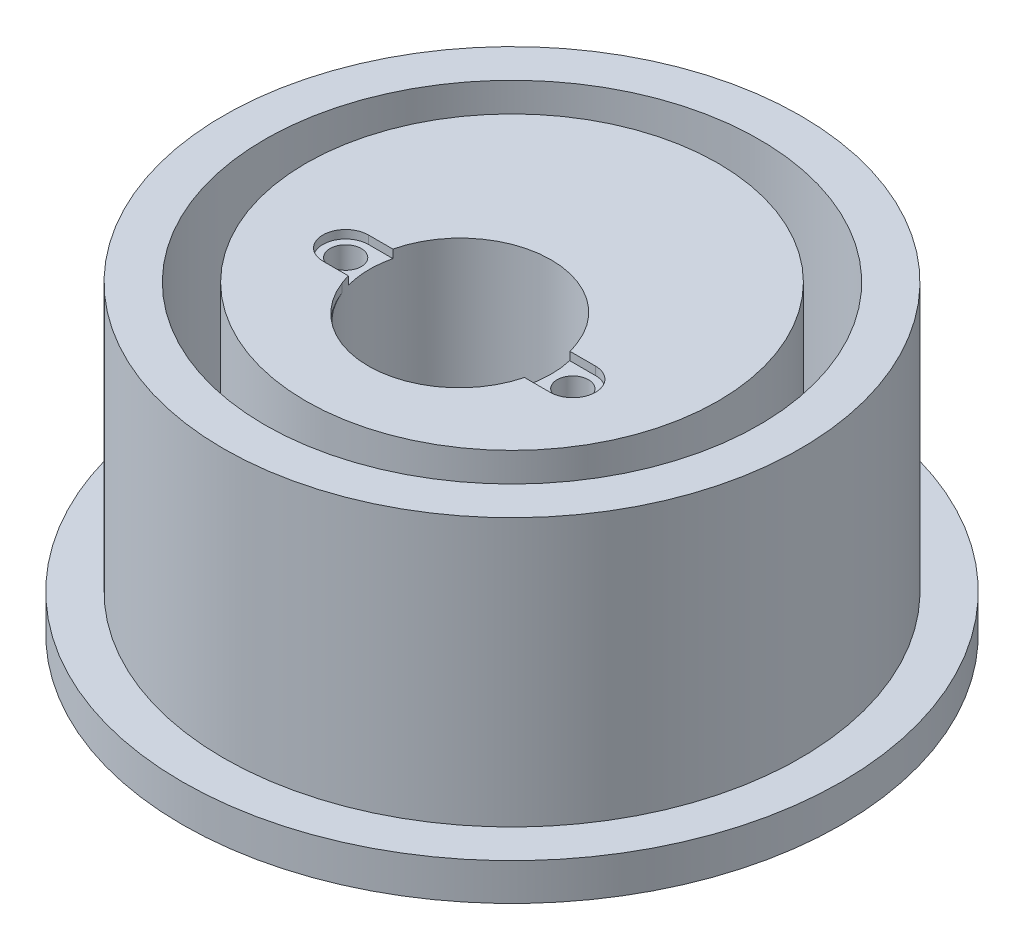
from build123d import *

# Parameters (mm, degrees)
SKETCH2_R           = 44.45
BOSS_EXTRUDE1_DEPTH = 6.35
SKETCH2_3_R         = 44.45
SKETCH2_3_R_2       = 38.1
BOSS_EXTRUDE2_DEPTH = 46.99
SKETCH3_R           = 31.75
SKETCH3_R_2         = 14
BOSS_EXTRUDE4_DEPTH = 40.64
CUT_EXTRUDE1_START  = -1.27
CUT_EXTRUDE1_DEPTH  = 1.27
SKETCH4_3_R         = 2.413
CUT_EXTRUDE2_DEPTH  = 8.89
SKETCH5_R           = 50.8
BOSS_EXTRUDE5_DEPTH = 5.715


with BuildPart() as part:
    # Sketch2 → Boss-Extrude1 (new body)
    with BuildSketch(Plane(origin=(0, 0, 0), x_dir=(1, 0, 0), z_dir=(0, 1, 0))):
        Circle(SKETCH2_R)
    extrude(amount=BOSS_EXTRUDE1_DEPTH)

    # Sketch2<3> → Boss-Extrude2 (add)
    with BuildSketch(Plane(origin=(0, 0, 0), x_dir=(1, 0, 0), z_dir=(0, 1, 0))):
        Circle(SKETCH2_3_R)
        Circle(SKETCH2_3_R_2, mode=Mode.SUBTRACT)
    extrude(amount=BOSS_EXTRUDE2_DEPTH)

    # Sketch3 → Boss-Extrude4 (add)
    with BuildSketch(Plane(origin=(0, 6.35, 0), x_dir=(1, 0, 0), z_dir=(0, 1, 0))):
        Circle(SKETCH3_R)
        with Locations((0.028088934, -8.000057344)):
            Circle(SKETCH3_R_2, mode=Mode.SUBTRACT)
    extrude(amount=BOSS_EXTRUDE4_DEPTH)

    # Sketch4 → Cut-Extrude1 (cut)
    with BuildSketch(Plane(origin=(0, 46.99, 0), x_dir=(1, 0, 0), z_dir=(0, 1, 0)).offset(CUT_EXTRUDE1_START)):
        with BuildLine():
            ThreePointArc((-13.456816363, -11.762679984), (-13.9692833, -8.271296235), (-13.592461269, -4.762679984))
            Line((-13.592461269, -4.762679984), (-17.368671482, -4.762679984))
            ThreePointArc((-17.368671482, -4.762679984), (-20.868671482, -8.262679984), (-17.368671482, -11.762679984))
            Line((-17.368671482, -11.762679984), (-13.456816363, -11.762679984))
        make_face()
        with BuildLine():
            ThreePointArc((13.68677023, -4.762679984), (13.426533126, -3.876618603), (13.108446408, -3.009641695))
            ThreePointArc((13.108446408, -3.009641695), (5.150076024, -21.029456726), (-12.949028956, -13.253095633))
            ThreePointArc((-12.949028956, -13.253095633), (0.913480012, -22.240814303), (13.68677023, -11.762679984))
            Line((13.68677023, -11.762679984), (17.631328518, -11.762679984))
            ThreePointArc((17.631328518, -11.762679984), (21.131328518, -8.262679984), (17.631328518, -4.762679984))
            Line((17.631328518, -4.762679984), (13.68677023, -4.762679984))
        make_face()
    extrude(amount=CUT_EXTRUDE1_DEPTH, mode=Mode.SUBTRACT)

    # Sketch4<3> → Cut-Extrude2 (cut)
    with BuildSketch(Plane(origin=(0, 46.99, 0), x_dir=(1, 0, 0), z_dir=(0, 1, 0))):
        with Locations((-17.368671482, -8.262679984)):
            Circle(SKETCH4_3_R)
        with Locations((17.631328518, -8.262679984)):
            Circle(SKETCH4_3_R)
    extrude(amount=-CUT_EXTRUDE2_DEPTH, mode=Mode.SUBTRACT)

    # Sketch5 → Boss-Extrude5 (add)
    with BuildSketch(Plane.XZ):
        Circle(SKETCH5_R)
    extrude(amount=-BOSS_EXTRUDE5_DEPTH)


solid = part.part
